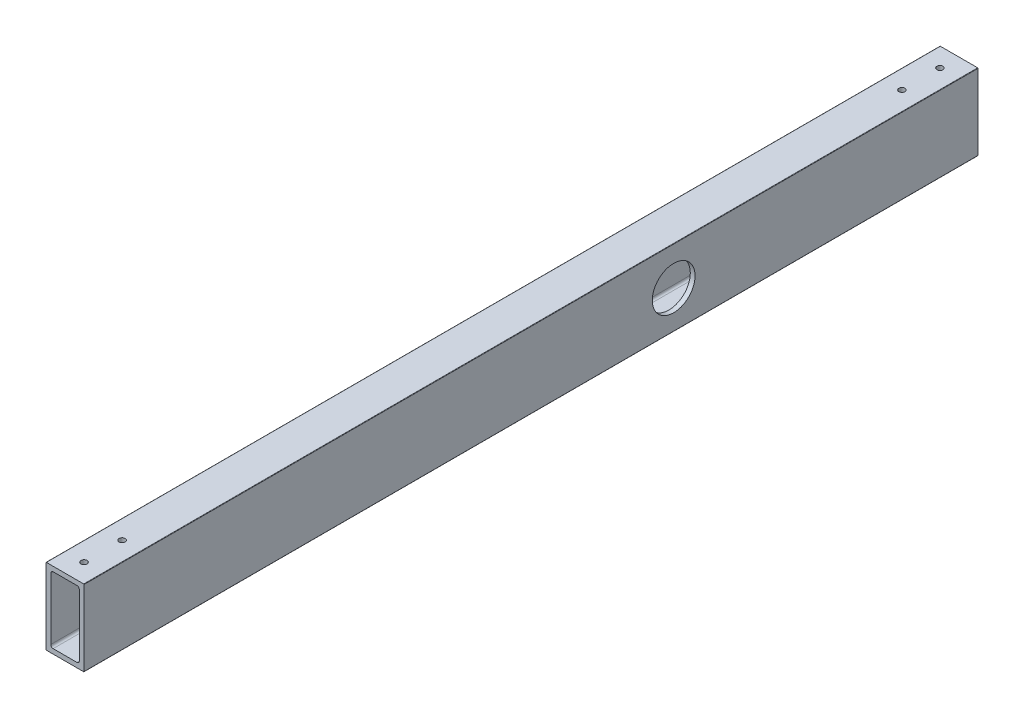
from build123d import *

# Parameters (mm, degrees)
BOSS_EXTRUDE1_DEPTH = 596.9
SKETCH2_R           = 2.032
CUT_EXTRUDE1_DEPTH  = 600.596039013
SKETCH5_R           = 14.2875
CUT_EXTRUDE2_DEPTH  = 600.596039013


with BuildPart() as part:
    # Sketch1 → Boss-Extrude1 (new body)
    with BuildSketch(Plane(origin=(0, 0, 0), x_dir=(-1, 0, 0), z_dir=(0, 0, -1))):
        with BuildLine():
            Line((0, 0.254), (0, 50.546))
            ThreePointArc((0, 50.546), (-0.074394878, 50.725605122), (-0.254, 50.8))
            Line((-0.254, 50.8), (-25.146, 50.8))
            ThreePointArc((-25.146, 50.8), (-25.325605122, 50.725605122), (-25.4, 50.546))
            Line((-25.4, 50.546), (-25.4, 0.254))
            ThreePointArc((-25.4, 0.254), (-25.325605122, 0.074394878), (-25.146, 0))
            Line((-25.146, 0), (-0.254, 0))
            ThreePointArc((-0.254, 0), (-0.074394878, 0.074394878), (0, 0.254))
        make_face()
        with BuildLine():
            Line((-3.175, 46.0375), (-3.175, 4.7625))
            ThreePointArc((-3.175, 4.7625), (-3.639967985, 3.639967985), (-4.7625, 3.175))
            Line((-4.7625, 3.175), (-20.6375, 3.175))
            ThreePointArc((-20.6375, 3.175), (-21.760032015, 3.639967985), (-22.225, 4.7625))
            Line((-22.225, 4.7625), (-22.225, 46.0375))
            ThreePointArc((-22.225, 46.0375), (-21.760032015, 47.160032015), (-20.6375, 47.625))
            Line((-20.6375, 47.625), (-4.7625, 47.625))
            ThreePointArc((-4.7625, 47.625), (-3.639967985, 47.160032015), (-3.175, 46.0375))
        make_face(mode=Mode.SUBTRACT)
    extrude(amount=-BOSS_EXTRUDE1_DEPTH)

    # Sketch2 → Cut-Extrude1 (cut, through all)
    with BuildSketch(Plane(origin=(0, 50.8, 0), x_dir=(1, 0, 0), z_dir=(0, 1, 0))):
        with Locations((12.7, -584.2)):
            Circle(SKETCH2_R)
        with Locations((12.7, -558.8)):
            Circle(SKETCH2_R)
        with Locations((12.7, -38.1)):
            Circle(SKETCH2_R)
        with Locations((12.7, -12.7)):
            Circle(SKETCH2_R)
    extrude(amount=-CUT_EXTRUDE1_DEPTH, mode=Mode.SUBTRACT)

    # Sketch5 → Cut-Extrude2 (cut, through all)
    with BuildSketch(Plane(origin=(25.4, 0, 0), x_dir=(0, 0, -1), z_dir=(1, 0, 0))):
        with Locations((-203.2, 25.146)):
            Circle(SKETCH5_R)
    extrude(amount=-CUT_EXTRUDE2_DEPTH, mode=Mode.SUBTRACT)


solid = part.part
